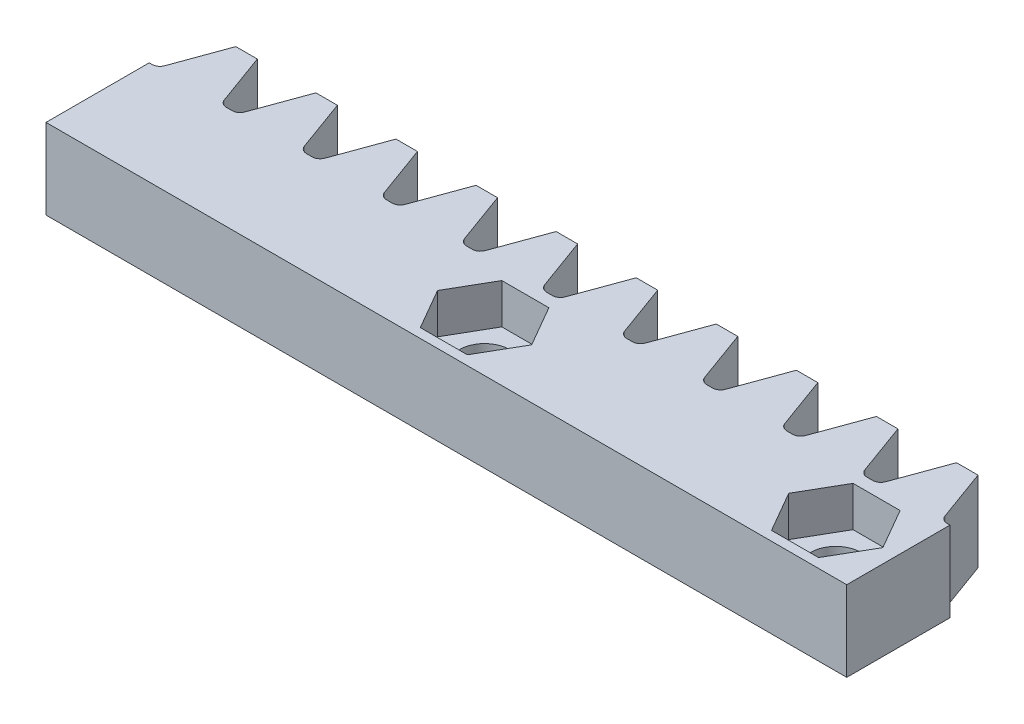
from build123d import *

# Parameters (mm, degrees)
SKETCH1_W           = 39.8982184
SKETCH1_H           = 5.1425094
BOSS_EXTRUDE1_DEPTH = 3.999992
BOSS_EXTRUDE2_START = -3.999992
BOSS_EXTRUDE2_DEPTH = 3.999992
CUT_EXTRUDE4_DEPTH  = 1.999996
SKETCH4_R           = 1.2494895
CUT_EXTRUDE5_DEPTH  = 22.586264202


# Read off the part's stored shape, not the designer's step: Boss-Extrude2
with BuildPart() as part:
    # Sketch1 → Boss-Extrude1 (new body)
    with BuildSketch(Plane(origin=(0, 0, 0), x_dir=(1, 0, 0), z_dir=(0, 1, 0))):
        with Locations((0, 2.5712547)):
            Rectangle(SKETCH1_W, SKETCH1_H)
    extrude(amount=BOSS_EXTRUDE1_DEPTH)

    # Boss-Extrude2 outline → Boss-Extrude2 (add)
    with BuildSketch(Plane(origin=(0, 3.999992, 0), x_dir=(1, 0, 0), z_dir=(0, 1, 0)).offset(BOSS_EXTRUDE2_START)):
        with BuildLine():
            Line((-19.809521572, 5.1425094), (-16.098890229, 5.1425094))
            ThreePointArc((-16.098890229, 5.1425094), (-16.328307217, 5.214844403), (-16.4747448, 5.405686069))
            Line((-16.4747448, 5.405686069), (-17.4189898, 7.999991269))
            Line((-17.4189898, 7.999991269), (-18.489422, 7.999991269))
            Line((-18.489422, 7.999991269), (-19.433667, 5.405686069))
            ThreePointArc((-19.433667, 5.405686069), (-19.580104584, 5.214844403), (-19.809521572, 5.1425094))
        make_face()
        with BuildLine():
            Line((-15.819722635, 5.1425094), (-12.109091292, 5.1425094))
            ThreePointArc((-12.109091292, 5.1425094), (-12.33850828, 5.214844403), (-12.484945863, 5.405686069))
            Line((-12.484945863, 5.405686069), (-13.429190863, 7.999991269))
            Line((-13.429190863, 7.999991269), (-14.499623063, 7.999991269))
            Line((-14.499623063, 7.999991269), (-15.443868063, 5.405686069))
            ThreePointArc((-15.443868063, 5.405686069), (-15.590305646, 5.214844403), (-15.819722635, 5.1425094))
        make_face()
        with BuildLine():
            Line((-11.829923697, 5.1425094), (-8.119292355, 5.1425094))
            ThreePointArc((-8.119292355, 5.1425094), (-8.348709343, 5.214844403), (-8.495146926, 5.405686069))
            Line((-8.495146926, 5.405686069), (-9.439391926, 7.999991269))
            Line((-9.439391926, 7.999991269), (-10.509824126, 7.999991269))
            Line((-10.509824126, 7.999991269), (-11.454069126, 5.405686069))
            ThreePointArc((-11.454069126, 5.405686069), (-11.600506709, 5.214844403), (-11.829923697, 5.1425094))
        make_face()
        with BuildLine():
            Line((-7.84012476, 5.1425094), (-4.129493418, 5.1425094))
            ThreePointArc((-4.129493418, 5.1425094), (-4.358910406, 5.214844403), (-4.505347989, 5.405686069))
            Line((-4.505347989, 5.405686069), (-5.449592989, 7.999991269))
            Line((-5.449592989, 7.999991269), (-6.520025189, 7.999991269))
            Line((-6.520025189, 7.999991269), (-7.464270189, 5.405686069))
            ThreePointArc((-7.464270189, 5.405686069), (-7.610707772, 5.214844403), (-7.84012476, 5.1425094))
        make_face()
        with BuildLine():
            Line((-3.850325823, 5.1425094), (-0.13969448, 5.1425094))
            ThreePointArc((-0.13969448, 5.1425094), (-0.369111469, 5.214844403), (-0.515549052, 5.405686069))
            Line((-0.515549052, 5.405686069), (-1.459794052, 7.999991269))
            Line((-1.459794052, 7.999991269), (-2.530226252, 7.999991269))
            Line((-2.530226252, 7.999991269), (-3.474471252, 5.405686069))
            ThreePointArc((-3.474471252, 5.405686069), (-3.620908835, 5.214844403), (-3.850325823, 5.1425094))
        make_face()
        with BuildLine():
            Line((0.139473114, 5.1425094), (3.850104457, 5.1425094))
            ThreePointArc((3.850104457, 5.1425094), (3.620687469, 5.214844403), (3.474249885, 5.405686069))
            Line((3.474249885, 5.405686069), (2.530004885, 7.999991269))
            Line((2.530004885, 7.999991269), (1.459572685, 7.999991269))
            Line((1.459572685, 7.999991269), (0.515327685, 5.405686069))
            ThreePointArc((0.515327685, 5.405686069), (0.368890102, 5.214844403), (0.139473114, 5.1425094))
        make_face()
        with BuildLine():
            Line((4.129272051, 5.1425094), (7.839903394, 5.1425094))
            ThreePointArc((7.839903394, 5.1425094), (7.610486406, 5.214844403), (7.464048822, 5.405686069))
            Line((7.464048822, 5.405686069), (6.519803822, 7.999991269))
            Line((6.519803822, 7.999991269), (5.449371622, 7.999991269))
            Line((5.449371622, 7.999991269), (4.505126622, 5.405686069))
            ThreePointArc((4.505126622, 5.405686069), (4.358689039, 5.214844403), (4.129272051, 5.1425094))
        make_face()
        with BuildLine():
            Line((8.119070988, 5.1425094), (11.829702331, 5.1425094))
            ThreePointArc((11.829702331, 5.1425094), (11.600285343, 5.214844403), (11.45384776, 5.405686069))
            Line((11.45384776, 5.405686069), (10.50960276, 7.999991269))
            Line((10.50960276, 7.999991269), (9.43917056, 7.999991269))
            Line((9.43917056, 7.999991269), (8.49492556, 5.405686069))
            ThreePointArc((8.49492556, 5.405686069), (8.348487976, 5.214844403), (8.119070988, 5.1425094))
        make_face()
        with BuildLine():
            Line((12.108869925, 5.1425094), (15.819501268, 5.1425094))
            ThreePointArc((15.819501268, 5.1425094), (15.59008428, 5.214844403), (15.443646697, 5.405686069))
            Line((15.443646697, 5.405686069), (14.499401697, 7.999991269))
            Line((14.499401697, 7.999991269), (13.428969497, 7.999991269))
            Line((13.428969497, 7.999991269), (12.484724497, 5.405686069))
            ThreePointArc((12.484724497, 5.405686069), (12.338286913, 5.214844403), (12.108869925, 5.1425094))
        make_face()
        with BuildLine():
            ThreePointArc((19.809300205, 5.1425094), (19.579883217, 5.214844403), (19.433445634, 5.405686069))
            Line((19.433445634, 5.405686069), (18.489200634, 7.999991269))
            Line((18.489200634, 7.999991269), (17.418768434, 7.999991269))
            Line((17.418768434, 7.999991269), (16.474523434, 5.405686069))
            ThreePointArc((16.474523434, 5.405686069), (16.328085851, 5.214844403), (16.098668862, 5.1425094))
            Line((16.098668862, 5.1425094), (19.809300205, 5.1425094))
        make_face()
    extrude(amount=BOSS_EXTRUDE2_DEPTH)

    # Sketch3 → Cut-Extrude4 (cut)
    with BuildSketch(Plane(origin=(0, 3.999992, 0), x_dir=(1, 0, 0), z_dir=(0, 1, 0))):
        Polygon((19.2496186, 2.5000077), (18.0770657, 4.530928897), (15.7319599, 4.530928897), (14.559407, 2.5000077), (15.7319599, 0.469086503), (18.0770657, 0.469086503), align=None)
        Polygon((1.7496282, 2.5000077), (0.5770753, 4.530928897), (-1.7680305, 4.530928897), (-2.9405834, 2.5000077), (-1.7680305, 0.469086503), (0.5770753, 0.469086503), align=None)
    extrude(amount=-CUT_EXTRUDE4_DEPTH, mode=Mode.SUBTRACT)

    # Sketch4 → Cut-Extrude5 (cut, through all)
    with BuildSketch(Plane(origin=(0, 1.999996, 0), x_dir=(1, 0, 0), z_dir=(0, 1, 0))):
        with Locations(Location((16.9045128, 2.5000077, 0), (0, 0, 270))):
            Circle(SKETCH4_R)
        with Locations(Location((-0.5954776, 2.5000077, 0), (0, 0, 270))):
            Circle(SKETCH4_R)
    extrude(amount=-CUT_EXTRUDE5_DEPTH, mode=Mode.SUBTRACT)


solid = part.part
